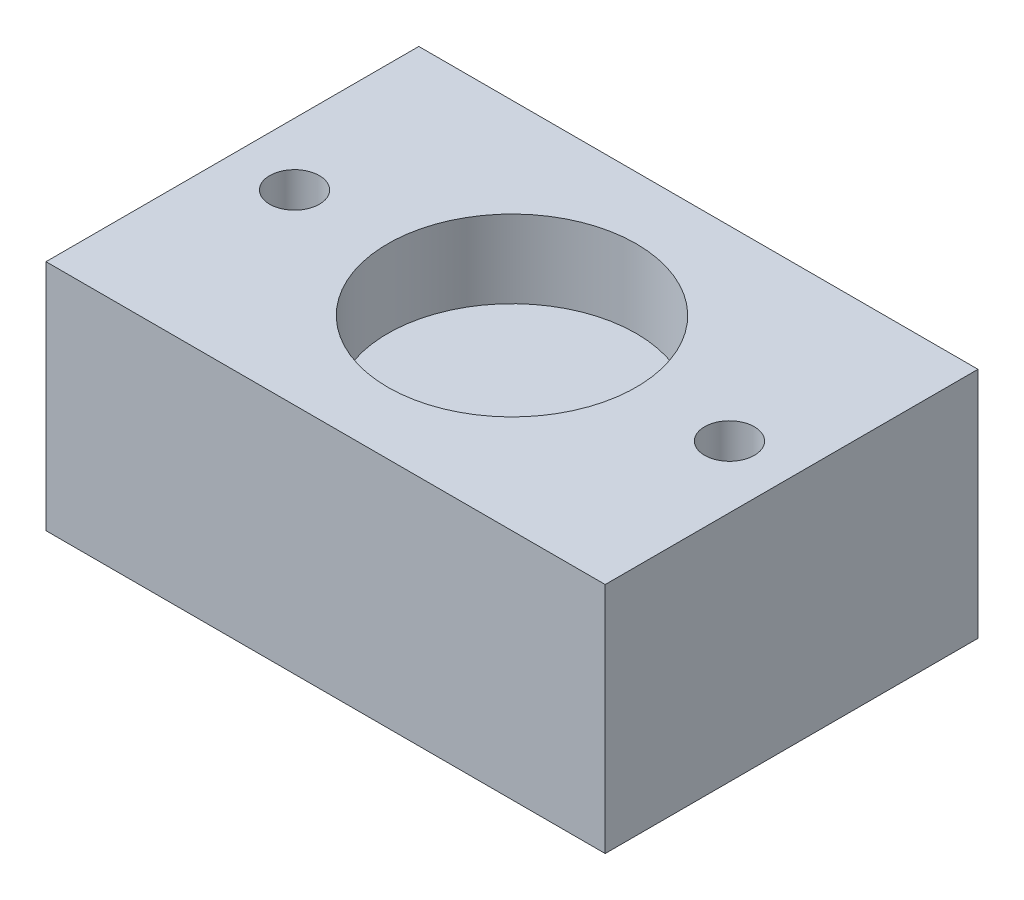
from build123d import *

# Parameters (mm, degrees)
SKETCH1_W                  = 36
SKETCH1_H                  = 24
BOSS_EXTRUDE1_DEPTH        = 15
SKETCH2_R                  = 8
CUT_EXTRUDE1_DEPTH         = 5
F_3_2_3_2_DIAMETER_HOLE1_D = 3.2


with BuildPart() as part:
    # Sketch1 → Boss-Extrude1 (new body)
    with BuildSketch(Plane(origin=(0, 0, 0), x_dir=(1, 0, 0), z_dir=(0, 1, 0))):
        with Locations((18, 12)):
            Rectangle(SKETCH1_W, SKETCH1_H)
    extrude(amount=BOSS_EXTRUDE1_DEPTH)

    # Sketch2 → Cut-Extrude1 (cut)
    with BuildSketch(Plane(origin=(0, 15, 0), x_dir=(1, 0, 0), z_dir=(0, 1, 0))):
        with Locations((18, 12)):
            Circle(SKETCH2_R)
    extrude(amount=-CUT_EXTRUDE1_DEPTH, mode=Mode.SUBTRACT)

    # Ø3.2 (3.2) Diameter Hole1 (through all)
    with Locations(Plane(origin=(0, 15, 0), x_dir=(1, 0, 0), z_dir=(0, 1, 0))):
        with Locations((4, 12), (32, 12)):
            Hole(F_3_2_3_2_DIAMETER_HOLE1_D / 2)


solid = part.part
